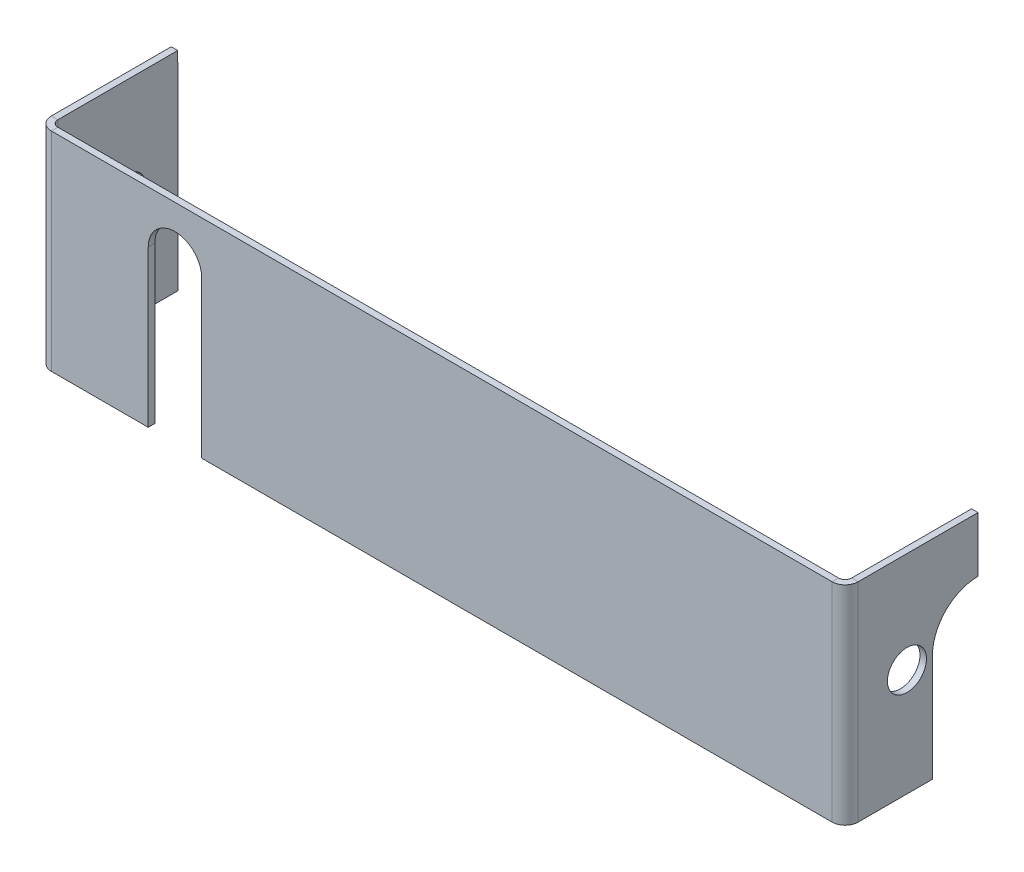
from build123d import *

# Parameters (mm, degrees)
BRIDA_BASE1_DEPTH     = 16
CROQUIS6_R            = 1.5
CORTAR_EXTRUIR6_DEPTH = 0.5
CROQUIS7_R            = 1.5
CORTAR_EXTRUIR7_DEPTH = 0.5
CORTAR_EXTRUIR8_DEPTH = 10


# Sheet-metal steps are written as plain solids
with BuildPart() as part:
    # Croquis1 → Brida base1 (new body)
    with BuildSketch(Plane(origin=(0, 0, 0), x_dir=(1, 0, 0), z_dir=(0, 1, 0))):
        with BuildLine():
            Line((-58.939086294, 3.693519459), (-58.939086294, -15.306480541))
            ThreePointArc((-58.939086294, -15.306480541), (-58.646193076, -16.013587323), (-57.939086294, -16.306480541))
            Line((-57.939086294, -16.306480541), (2.060913706, -16.306480541))
            ThreePointArc((2.060913706, -16.306480541), (2.768020487, -16.013587323), (3.060913706, -15.306480541))
            Line((3.060913706, -15.306480541), (3.060913706, 3.693519459))
            Line((3.060913706, 3.693519459), (2.560913706, 3.693519459))
            Line((2.560913706, 3.693519459), (2.560913706, -15.306480541))
            ThreePointArc((2.560913706, -15.306480541), (2.414467096, -15.660033932), (2.060913706, -15.806480541))
            Line((2.060913706, -15.806480541), (-57.939086294, -15.806480541))
            ThreePointArc((-57.939086294, -15.806480541), (-58.292639685, -15.660033932), (-58.439086294, -15.306480541))
            Line((-58.439086294, -15.306480541), (-58.439086294, 3.693519459))
            Line((-58.439086294, 3.693519459), (-58.939086294, 3.693519459))
        make_face()
    extrude(amount=BRIDA_BASE1_DEPTH)

    # Croquis6 → Cortar-Extruir6 (cut)
    with BuildSketch(Plane(origin=(3.060913706, 0, 0), x_dir=(0, 0, -1), z_dir=(1, 0, 0))):
        with Locations((-11.555105987, 8.25)):
            Circle(CROQUIS6_R)
        with BuildLine():
            Line((-9.595105987, 8.25), (-9.595105987, 0))
            Line((-9.595105987, 0), (3.693519459, 0))
            Line((3.693519459, 0), (3.693519459, 16))
            Line((3.693519459, 16), (-6.095105987, 16))
            Line((-6.095105987, 16), (-6.095105987, 11.75))
            ThreePointArc((-6.095105987, 11.75), (-8.569979721, 10.724873734), (-9.595105987, 8.25))
        make_face()
    extrude(amount=-CORTAR_EXTRUIR6_DEPTH, mode=Mode.SUBTRACT)

    # Croquis7 → Cortar-Extruir7 (cut)
    with BuildSketch(Plane.ZY.offset(58.939086294)):
        with Locations((10.056480541, 8.25)):
            Circle(CROQUIS7_R)
        Polygon((6.095105987, 16), (6.056480541, 0), (-3.693519459, 0), (-3.693519459, 16), align=None)
    extrude(amount=-CORTAR_EXTRUIR7_DEPTH, mode=Mode.SUBTRACT)

    # Croquis8 → Cortar-Extruir8 (cut)
    with BuildSketch(Plane.XY.offset(16.306480541)):
        with BuildLine():
            Line((-50.493414499, 12), (-50.493414499, 3.818786101))
            Line((-50.493414499, 3.818786101), (-50.493414499, 0))
            Line((-50.493414499, 0), (-46.38475809, 0))
            Line((-46.38475809, 0), (-46.38475809, 3.818786101))
            Line((-46.38475809, 3.818786101), (-46.38475809, 12))
            ThreePointArc((-46.38475809, 12), (-48.439086294, 14.054328205), (-50.493414499, 12))
        make_face()
    extrude(amount=-CORTAR_EXTRUIR8_DEPTH, mode=Mode.SUBTRACT)


solid = part.part
